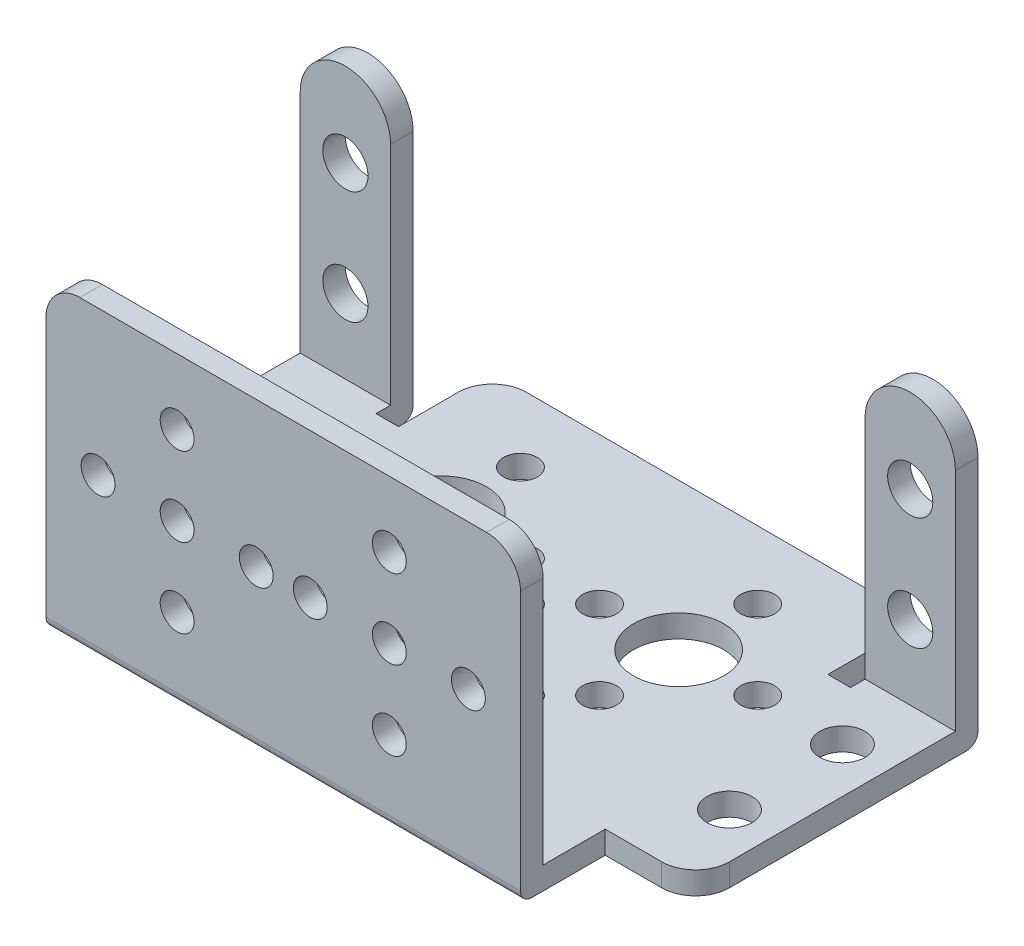
from build123d import *

# Parameters (mm, degrees)
SKETCH1_R               = 2
SKETCH1_R_2             = 4
SKETCH1_R_3             = 1.5
BOSS_EXTRUDE1_DEPTH     = 27
CUT_EXTRUDE1_DEPTH      = 55.555018101
CUT_EXTRUDE1_DEPTH_BACK = 55.555018101
SKETCH3_W               = 28.5
SKETCH3_H               = 26.527175283
SKETCH3_W_2             = 6.268481117
SKETCH4_R               = 2
SKETCH4_R_2             = 1.5
CUT_EXTRUDE2_DEPTH      = 55.555018101
SKETCH5_W               = 38
SKETCH5_H               = 27.064125823
CUT_EXTRUDE3_DEPTH      = 27
FILLET1_R               = 3
FILLET2_R               = 1


with BuildPart() as part:
    # Sketch1 → Boss-Extrude1 (new body)
    with BuildSketch(Plane(origin=(0, 0, 0), x_dir=(1, 0, 0), z_dir=(0, 1, 0))):
        with BuildLine():
            Line((21, 0), (-21, 0))
            Line((-21, 0), (-21, 7.5))
            Line((-21, 7.5), (-26, 7.5))
            ThreePointArc((-26, 7.5), (-28.121320344, 8.378679656), (-29, 10.5))
            Line((-29, 10.5), (-29, 32.5))
            Line((-29, 32.5), (-21, 32.5))
            Line((-21, 32.5), (-21, 29.209337349))
            Line((-21, 29.209337349), (-19, 29.209337349))
            Line((-19, 29.209337349), (-19, 34.5))
            ThreePointArc((-19, 34.5), (-18.121320344, 36.621320344), (-16, 37.5))
            Line((-16, 37.5), (16, 37.5))
            ThreePointArc((16, 37.5), (18.121320344, 36.621320344), (19, 34.5))
            Line((19, 34.5), (19, 29.209337349))
            Line((19, 29.209337349), (21, 29.209337349))
            Line((21, 29.209337349), (21, 32.5))
            Line((21, 32.5), (29, 32.5))
            Line((29, 32.5), (29, 10.5))
            ThreePointArc((29, 10.5), (28.121320344, 8.378679656), (26, 7.5))
            Line((26, 7.5), (21, 7.5))
            Line((21, 7.5), (21, 0))
        make_face()
        with Locations((-25, 24.5)):
            Circle(SKETCH1_R, mode=Mode.SUBTRACT)
        with Locations((-25, 14.5)):
            Circle(SKETCH1_R, mode=Mode.SUBTRACT)
        with Locations((25, 14.5)):
            Circle(SKETCH1_R, mode=Mode.SUBTRACT)
        with Locations((25, 24.5)):
            Circle(SKETCH1_R, mode=Mode.SUBTRACT)
        with Locations((0, 14)):
            Circle(SKETCH1_R_2, mode=Mode.SUBTRACT)
        with Locations((0, 21)):
            Circle(SKETCH1_R_3, mode=Mode.SUBTRACT)
        with Locations((7, 14)):
            Circle(SKETCH1_R_3, mode=Mode.SUBTRACT)
        with Locations((0, 7)):
            Circle(SKETCH1_R_3, mode=Mode.SUBTRACT)
        with Locations((-7, 14)):
            Circle(SKETCH1_R_3, mode=Mode.SUBTRACT)
        with Locations((10.5, 24.5)):
            Circle(SKETCH1_R_2, mode=Mode.SUBTRACT)
        with Locations((10.5, 31.5)):
            Circle(SKETCH1_R_3, mode=Mode.SUBTRACT)
        with Locations((-10.5, 24.5)):
            Circle(SKETCH1_R_2, mode=Mode.SUBTRACT)
        with Locations((-10.5, 31.5)):
            Circle(SKETCH1_R_3, mode=Mode.SUBTRACT)
        with Locations((3.5, 24.5)):
            Circle(SKETCH1_R_3, mode=Mode.SUBTRACT)
        with Locations((10.5, 17.5)):
            Circle(SKETCH1_R_3, mode=Mode.SUBTRACT)
        with Locations((17.5, 24.5)):
            Circle(SKETCH1_R_3, mode=Mode.SUBTRACT)
        with Locations((-3.5, 24.5)):
            Circle(SKETCH1_R_3, mode=Mode.SUBTRACT)
        with Locations((-10.5, 17.5)):
            Circle(SKETCH1_R_3, mode=Mode.SUBTRACT)
        with Locations((-17.5, 24.5)):
            Circle(SKETCH1_R_3, mode=Mode.SUBTRACT)
    extrude(amount=BOSS_EXTRUDE1_DEPTH)

    # Sketch3 → Cut-Extrude1 (cut, two sides: drawn at the far end of the back side and taken through both)
    with BuildSketch(Plane(origin=(0, 0, 0), x_dir=(0, 0, -1), z_dir=(1, 0, 0)).offset(-CUT_EXTRUDE1_DEPTH_BACK)):
        with Locations((16.25, 15.263587642)):
            Rectangle(SKETCH3_W, SKETCH3_H)
        with Locations((35.691254192, 15.263587642)):
            Rectangle(SKETCH3_W_2, SKETCH3_H)
    extrude(amount=CUT_EXTRUDE1_DEPTH + CUT_EXTRUDE1_DEPTH_BACK, mode=Mode.SUBTRACT)

    # Sketch4 → Cut-Extrude2 (cut, through all)
    with BuildSketch(Plane.XY):
        with Locations((-25, 18.573417332)):
            Circle(SKETCH4_R)
        with Locations((-25, 8.573417332)):
            Circle(SKETCH4_R)
        with Locations((-9.391233077, 21.187393838)):
            Circle(SKETCH4_R_2)
        with Locations((-2.391233077, 14.187393838)):
            Circle(SKETCH4_R_2)
        with Locations((-9.391233077, 7.187393838)):
            Circle(SKETCH4_R_2)
        with Locations((-16.391233077, 14.187393838)):
            Circle(SKETCH4_R_2)
        with Locations((2.391233077, 14.187393838)):
            Circle(SKETCH4_R_2)
        with Locations((16.391233077, 14.187393838)):
            Circle(SKETCH4_R_2)
        with Locations((9.391233077, 7.187393838)):
            Circle(SKETCH4_R_2)
        with Locations((9.391233077, 21.187393838)):
            Circle(SKETCH4_R_2)
        with Locations((25, 8.573417332)):
            Circle(SKETCH4_R)
        with Locations((25, 18.573417332)):
            Circle(SKETCH4_R)
        with Locations((-9.391233077, 14.187393838)):
            Circle(SKETCH4_R_2)
        with Locations((9.391233077, 14.187393838)):
            Circle(SKETCH4_R_2)
        with BuildLine():
            Line((-29, 22), (-29, 28.587976658))
            Line((-29, 28.587976658), (-21, 28.587976658))
            Line((-21, 28.587976658), (-21, 22))
            ThreePointArc((-21, 22), (-25, 26), (-29, 22))
        make_face()
        with BuildLine():
            Line((21, 28.587976658), (21, 22))
            ThreePointArc((21, 22), (25, 26), (29, 22))
            Line((29, 22), (29, 28.587976658))
            Line((29, 28.587976658), (21, 28.587976658))
        make_face()
    extrude(amount=-CUT_EXTRUDE2_DEPTH, mode=Mode.SUBTRACT)

    # Sketch5 → Cut-Extrude3 (cut)
    with BuildSketch(Plane(origin=(0, 0, -32.557013634), x_dir=(-1, 0, 0), z_dir=(0, 0, -1))):
        with Locations((0, 15.532062912)):
            Rectangle(SKETCH5_W, SKETCH5_H)
    extrude(amount=-CUT_EXTRUDE3_DEPTH, mode=Mode.SUBTRACT)

    # Fillet1
    fillet1_edges = [part.edges().sort_by_distance(p)[0] for p in [
        (21, 27, -1),
        (-21, 27, -1),
    ]]
    fillet(fillet1_edges, radius=FILLET1_R)

    # Fillet2
    fillet2_edges = [part.edges().sort_by_distance(p)[0] for p in [
        (-25, 0, -32.5),
        (25, 0, -32.5),
        (0, 0, 0),
    ]]
    fillet(fillet2_edges, radius=FILLET2_R)


solid = part.part
